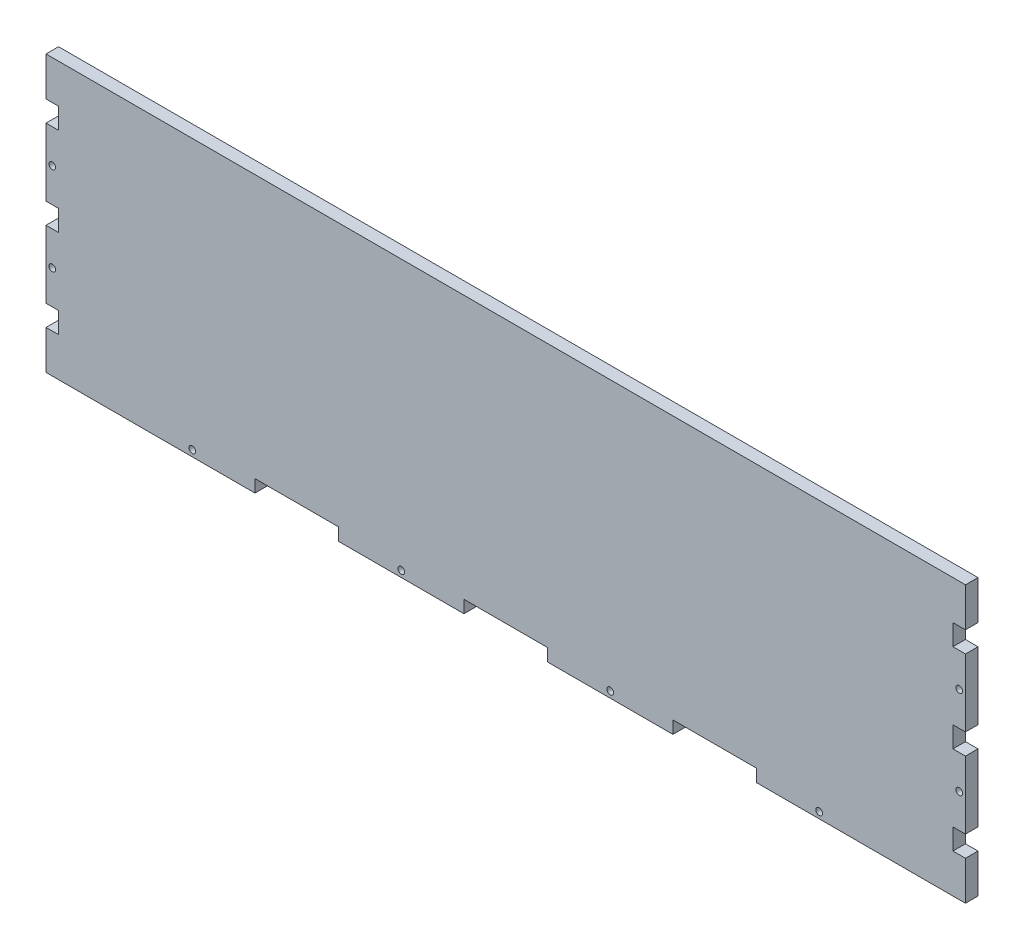
from build123d import *

# Parameters (mm, degrees)
SKETCH1_W           = 440
SKETCH1_H           = 132
BOSS_EXTRUDE1_DEPTH = 6
CUT_EXTRUDE1_REACH  = 231.765
SKETCH2_R           = 1.6
SKETCH2_W           = 6
SKETCH2_H           = 10
CUT_EXTRUDE2_REACH  = 231.765
SKETCH3_R           = 1.6
CUT_EXTRUDE3_REACH  = 231.765
SKETCH4_W           = 40
SKETCH4_H           = 6


with BuildPart() as part:
    # Sketch1 → Boss-Extrude1 (new body)
    with BuildSketch(Plane.XY):
        Rectangle(SKETCH1_W, SKETCH1_H)
    extrude(amount=BOSS_EXTRUDE1_DEPTH)

    # Sketch2 → Cut-Extrude1 (cut, up to next)
    with BuildSketch(Plane(origin=(0, 0, 0), x_dir=(-1, 0, 0), z_dir=(0, 0, -1)), mode=Mode.PRIVATE) as cut_extrude1_sk1:
        with Locations((217, 21.166064391)):
            Circle(SKETCH2_R)
    cut_extrude1_tool1 = extrude(cut_extrude1_sk1.sketch, amount=-CUT_EXTRUDE1_REACH, mode=Mode.PRIVATE) & part.part
    # Sketch2 → Cut-Extrude1 (cut, up to next)
    with BuildSketch(Plane(origin=(0, 0, 0), x_dir=(-1, 0, 0), z_dir=(0, 0, -1)), mode=Mode.PRIVATE) as cut_extrude1_sk2:
        with Locations((217, -21.166064391)):
            Circle(SKETCH2_R)
    cut_extrude1_tool2 = extrude(cut_extrude1_sk2.sketch, amount=-CUT_EXTRUDE1_REACH, mode=Mode.PRIVATE) & part.part
    # Sketch2 → Cut-Extrude1 (cut, up to next)
    with BuildSketch(Plane(origin=(0, 0, 0), x_dir=(-1, 0, 0), z_dir=(0, 0, -1)), mode=Mode.PRIVATE) as cut_extrude1_sk3:
        with Locations((-217, 21.166064391)):
            Circle(SKETCH2_R)
    cut_extrude1_tool3 = extrude(cut_extrude1_sk3.sketch, amount=-CUT_EXTRUDE1_REACH, mode=Mode.PRIVATE) & part.part
    # Sketch2 → Cut-Extrude1 (cut, up to next)
    with BuildSketch(Plane(origin=(0, 0, 0), x_dir=(-1, 0, 0), z_dir=(0, 0, -1)), mode=Mode.PRIVATE) as cut_extrude1_sk4:
        with Locations((-217, -21.166064391)):
            Circle(SKETCH2_R)
    cut_extrude1_tool4 = extrude(cut_extrude1_sk4.sketch, amount=-CUT_EXTRUDE1_REACH, mode=Mode.PRIVATE) & part.part
    # Sketch2 → Cut-Extrude1 (cut, up to next)
    with BuildSketch(Plane(origin=(0, 0, 0), x_dir=(-1, 0, 0), z_dir=(0, 0, -1)), mode=Mode.PRIVATE) as cut_extrude1_sk5:
        with Locations((217, 42.332128782)):
            Rectangle(SKETCH2_W, SKETCH2_H)
    cut_extrude1_tool5 = extrude(cut_extrude1_sk5.sketch, amount=-CUT_EXTRUDE1_REACH, mode=Mode.PRIVATE) & part.part
    # Sketch2 → Cut-Extrude1 (cut, up to next)
    with BuildSketch(Plane(origin=(0, 0, 0), x_dir=(-1, 0, 0), z_dir=(0, 0, -1)), mode=Mode.PRIVATE) as cut_extrude1_sk6:
        with Locations((217, -42.332128782)):
            Rectangle(SKETCH2_W, SKETCH2_H)
    cut_extrude1_tool6 = extrude(cut_extrude1_sk6.sketch, amount=-CUT_EXTRUDE1_REACH, mode=Mode.PRIVATE) & part.part
    # Sketch2 → Cut-Extrude1 (cut, up to next)
    with BuildSketch(Plane(origin=(0, 0, 0), x_dir=(-1, 0, 0), z_dir=(0, 0, -1)), mode=Mode.PRIVATE) as cut_extrude1_sk7:
        with Locations((-217, -42.332128782)):
            Rectangle(SKETCH2_W, SKETCH2_H)
    cut_extrude1_tool7 = extrude(cut_extrude1_sk7.sketch, amount=-CUT_EXTRUDE1_REACH, mode=Mode.PRIVATE) & part.part
    # Sketch2 → Cut-Extrude1 (cut, up to next)
    with BuildSketch(Plane(origin=(0, 0, 0), x_dir=(-1, 0, 0), z_dir=(0, 0, -1)), mode=Mode.PRIVATE) as cut_extrude1_sk8:
        with Locations((-217, 42.332128782)):
            Rectangle(SKETCH2_W, SKETCH2_H)
    cut_extrude1_tool8 = extrude(cut_extrude1_sk8.sketch, amount=-CUT_EXTRUDE1_REACH, mode=Mode.PRIVATE) & part.part
    # Sketch2 → Cut-Extrude1 (cut, up to next)
    with BuildSketch(Plane(origin=(0, 0, 0), x_dir=(-1, 0, 0), z_dir=(0, 0, -1)), mode=Mode.PRIVATE) as cut_extrude1_sk9:
        with Locations((217, 0)):
            Rectangle(SKETCH2_W, SKETCH2_H)
    cut_extrude1_tool9 = extrude(cut_extrude1_sk9.sketch, amount=-CUT_EXTRUDE1_REACH, mode=Mode.PRIVATE) & part.part
    # Sketch2 → Cut-Extrude1 (cut, up to next)
    with BuildSketch(Plane(origin=(0, 0, 0), x_dir=(-1, 0, 0), z_dir=(0, 0, -1)), mode=Mode.PRIVATE) as cut_extrude1_sk10:
        with Locations((-217, 0)):
            Rectangle(SKETCH2_W, SKETCH2_H)
    cut_extrude1_tool10 = extrude(cut_extrude1_sk10.sketch, amount=-CUT_EXTRUDE1_REACH, mode=Mode.PRIVATE) & part.part
    add(cut_extrude1_tool1.solids().sort_by_distance((-217, 21.166064, 0))[0], mode=Mode.SUBTRACT)
    add(cut_extrude1_tool2.solids().sort_by_distance((-217, -21.166064, 0))[0], mode=Mode.SUBTRACT)
    add(cut_extrude1_tool3.solids().sort_by_distance((217, 21.166064, 0))[0], mode=Mode.SUBTRACT)
    add(cut_extrude1_tool4.solids().sort_by_distance((217, -21.166064, 0))[0], mode=Mode.SUBTRACT)
    add(cut_extrude1_tool5.solids().sort_by_distance((-217, 42.332129, 0))[0], mode=Mode.SUBTRACT)
    add(cut_extrude1_tool6.solids().sort_by_distance((-217, -42.332129, 0))[0], mode=Mode.SUBTRACT)
    add(cut_extrude1_tool7.solids().sort_by_distance((217, -42.332129, 0))[0], mode=Mode.SUBTRACT)
    add(cut_extrude1_tool8.solids().sort_by_distance((217, 42.332129, 0))[0], mode=Mode.SUBTRACT)
    add(cut_extrude1_tool9.solids().sort_by_distance((-217, 0, 0))[0], mode=Mode.SUBTRACT)
    add(cut_extrude1_tool10.solids().sort_by_distance((217, 0, 0))[0], mode=Mode.SUBTRACT)

    # Sketch3 → Cut-Extrude2 (cut, up to next)
    with BuildSketch(Plane(origin=(0, 0, 0), x_dir=(-1, 0, 0), z_dir=(0, 0, -1)), mode=Mode.PRIVATE) as cut_extrude2_sk1:
        with Locations((-150, -63)):
            Circle(SKETCH3_R)
    cut_extrude2_tool1 = extrude(cut_extrude2_sk1.sketch, amount=-CUT_EXTRUDE2_REACH, mode=Mode.PRIVATE) & part.part
    # Sketch3 → Cut-Extrude2 (cut, up to next)
    with BuildSketch(Plane(origin=(0, 0, 0), x_dir=(-1, 0, 0), z_dir=(0, 0, -1)), mode=Mode.PRIVATE) as cut_extrude2_sk2:
        with Locations((-50, -63)):
            Circle(SKETCH3_R)
    cut_extrude2_tool2 = extrude(cut_extrude2_sk2.sketch, amount=-CUT_EXTRUDE2_REACH, mode=Mode.PRIVATE) & part.part
    # Sketch3 → Cut-Extrude2 (cut, up to next)
    with BuildSketch(Plane(origin=(0, 0, 0), x_dir=(-1, 0, 0), z_dir=(0, 0, -1)), mode=Mode.PRIVATE) as cut_extrude2_sk3:
        with Locations((50, -63)):
            Circle(SKETCH3_R)
    cut_extrude2_tool3 = extrude(cut_extrude2_sk3.sketch, amount=-CUT_EXTRUDE2_REACH, mode=Mode.PRIVATE) & part.part
    # Sketch3 → Cut-Extrude2 (cut, up to next)
    with BuildSketch(Plane(origin=(0, 0, 0), x_dir=(-1, 0, 0), z_dir=(0, 0, -1)), mode=Mode.PRIVATE) as cut_extrude2_sk4:
        with Locations((150, -63)):
            Circle(SKETCH3_R)
    cut_extrude2_tool4 = extrude(cut_extrude2_sk4.sketch, amount=-CUT_EXTRUDE2_REACH, mode=Mode.PRIVATE) & part.part
    add(cut_extrude2_tool1.solids().sort_by_distance((150, -63, 0))[0], mode=Mode.SUBTRACT)
    add(cut_extrude2_tool2.solids().sort_by_distance((50, -63, 0))[0], mode=Mode.SUBTRACT)
    add(cut_extrude2_tool3.solids().sort_by_distance((-50, -63, 0))[0], mode=Mode.SUBTRACT)
    add(cut_extrude2_tool4.solids().sort_by_distance((-150, -63, 0))[0], mode=Mode.SUBTRACT)

    # Sketch4 → Cut-Extrude3 (cut, up to next)
    with BuildSketch(Plane(origin=(0, 0, 0), x_dir=(-1, 0, 0), z_dir=(0, 0, -1)), mode=Mode.PRIVATE) as cut_extrude3_sk1:
        with Locations((100, -63)):
            Rectangle(SKETCH4_W, SKETCH4_H)
    cut_extrude3_tool1 = extrude(cut_extrude3_sk1.sketch, amount=-CUT_EXTRUDE3_REACH, mode=Mode.PRIVATE) & part.part
    # Sketch4 → Cut-Extrude3 (cut, up to next)
    with BuildSketch(Plane(origin=(0, 0, 0), x_dir=(-1, 0, 0), z_dir=(0, 0, -1)), mode=Mode.PRIVATE) as cut_extrude3_sk2:
        with Locations((0, -63)):
            Rectangle(SKETCH4_W, SKETCH4_H)
    cut_extrude3_tool2 = extrude(cut_extrude3_sk2.sketch, amount=-CUT_EXTRUDE3_REACH, mode=Mode.PRIVATE) & part.part
    # Sketch4 → Cut-Extrude3 (cut, up to next)
    with BuildSketch(Plane(origin=(0, 0, 0), x_dir=(-1, 0, 0), z_dir=(0, 0, -1)), mode=Mode.PRIVATE) as cut_extrude3_sk3:
        with Locations((-100, -63)):
            Rectangle(SKETCH4_W, SKETCH4_H)
    cut_extrude3_tool3 = extrude(cut_extrude3_sk3.sketch, amount=-CUT_EXTRUDE3_REACH, mode=Mode.PRIVATE) & part.part
    add(cut_extrude3_tool1.solids().sort_by_distance((-100, -63, 0))[0], mode=Mode.SUBTRACT)
    add(cut_extrude3_tool2.solids().sort_by_distance((0, -63, 0))[0], mode=Mode.SUBTRACT)
    add(cut_extrude3_tool3.solids().sort_by_distance((100, -63, 0))[0], mode=Mode.SUBTRACT)


solid = part.part
